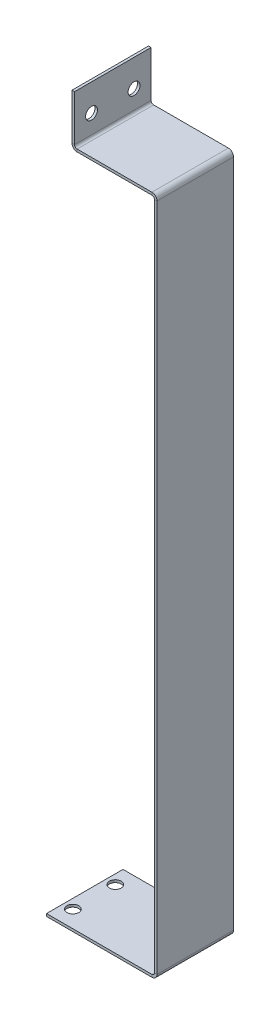
from build123d import *

# Parameters (mm, degrees)
SM_BASE_FLANGE_1_DEPTH = 45
SKETCH_6_R             = 3.5
CUT_EXTRUDE_1_DEPTH    = 10
SKETCH_7_R             = 3.5
CUT_EXTRUDE_2_DEPTH    = 10


# Sheet-metal steps are written as plain solids
with BuildPart() as part:
    # Sketch 1 → Базовая кромка1 (new body)
    with BuildSketch(Plane.XY):
        with BuildLine():
            Line((-48.5, 428.5), (-48.5, 401.5))
            ThreePointArc((-48.5, 401.5), (-48.060660172, 400.439339828), (-47, 400))
            Line((-47, 400), (-3, 400))
            ThreePointArc((-3, 400), (-0.878679656, 399.121320344), (0, 397))
            Line((0, 397), (0, 3))
            ThreePointArc((0, 3), (-0.878679656, 0.878679656), (-3, 0))
            Line((-3, 0), (-65, 0))
            Line((-65, 0), (-65, 1.5))
            Line((-65, 1.5), (-3, 1.5))
            ThreePointArc((-3, 1.5), (-1.939339828, 1.939339828), (-1.5, 3))
            Line((-1.5, 3), (-1.5, 397))
            ThreePointArc((-1.5, 397), (-1.939339828, 398.060660172), (-3, 398.5))
            Line((-3, 398.5), (-47, 398.5))
            ThreePointArc((-47, 398.5), (-49.121320344, 399.378679656), (-50, 401.5))
            Line((-50, 401.5), (-50, 428.5))
            Line((-50, 428.5), (-48.5, 428.5))
        make_face()
    extrude(amount=-SM_BASE_FLANGE_1_DEPTH)

    # Эскиз6 → Вырез-Вытянуть1 (cut)
    with BuildSketch(Plane(origin=(0, 1.5, 0), x_dir=(1, 0, 0), z_dir=(0, 1, 0))):
        with Locations(Location((-59.5, 35, 0), (0, 0, 180))):
            Circle(SKETCH_6_R)
        with Locations(Location((-59.5, 10, 0), (0, 0, 180))):
            Circle(SKETCH_6_R)
    extrude(amount=-CUT_EXTRUDE_1_DEPTH, mode=Mode.SUBTRACT)

    # Эскиз7 → Вырез-Вытянуть2 (cut)
    with BuildSketch(Plane.ZY.offset(50)):
        with Locations((-35, 412.5)):
            Circle(SKETCH_7_R)
        with Locations((-10, 412.5)):
            Circle(SKETCH_7_R)
    extrude(amount=-CUT_EXTRUDE_2_DEPTH, mode=Mode.SUBTRACT)


solid = part.part
